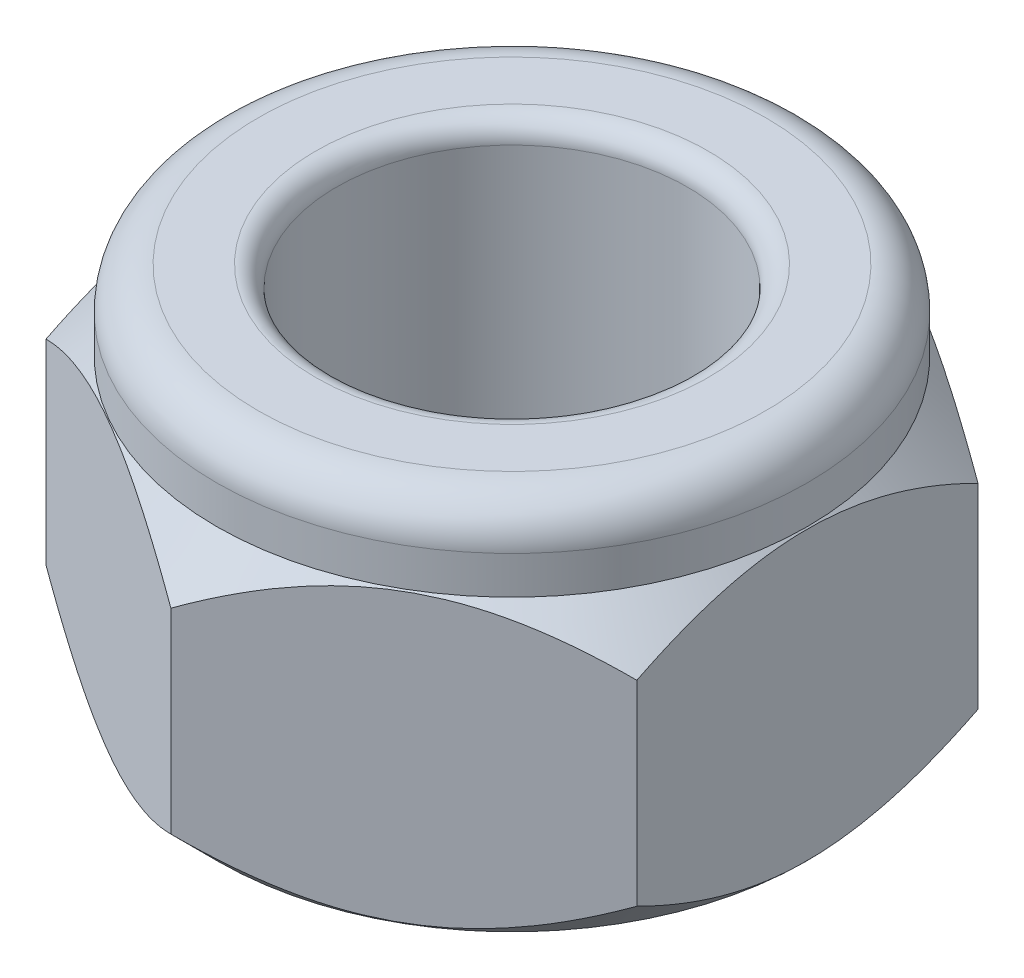
from build123d import *
from build123d.topology import SkipClean

# Parameters (mm, degrees)
SKETCH1_R                   = 4
BOSS_EXTRUDE1_DEPTH         = 7
F_3_8_24_TAPPED_HOLE6_D     = 8.4328
F_3_8_24_TAPPED_HOLE6_DEPTH = 15.3
F_3_8_24_TAPPED_HOLE6_TIP   = 2.533468714
SKETCH9_R                   = 7.1
SKETCH9_R_2                 = 4.2164
BOSS_EXTRUDE3_DEPTH         = 1.91
FILLET3_R                   = 1
FILLET4_R                   = 0.5


with BuildPart() as part:
    # Sketch1 → Boss-Extrude1 (new body)
    with BuildSketch(Plane(origin=(0, 0, 0), x_dir=(1, 0, 0), z_dir=(0, 1, 0))):
        Polygon((0, 8.198373822), (-7.1, 4.099186911), (-7.1, -4.099186911), (0, -8.198373822), (7.1, -4.099186911), (7.1, 4.099186911), align=None)
        Circle(SKETCH1_R, mode=Mode.SUBTRACT)
    extrude(amount=BOSS_EXTRUDE1_DEPTH)

    # 3/8-24 Tapped Hole6
    with Locations(Plane.ZX.offset(7)):
        with Locations((0, 0)):
            Hole(F_3_8_24_TAPPED_HOLE6_D / 2, depth=F_3_8_24_TAPPED_HOLE6_DEPTH)
            with Locations((0, 0, -(F_3_8_24_TAPPED_HOLE6_DEPTH + F_3_8_24_TAPPED_HOLE6_TIP / 2))):  # 118° drill point
                Cone(0, F_3_8_24_TAPPED_HOLE6_D / 2, F_3_8_24_TAPPED_HOLE6_TIP, mode=Mode.SUBTRACT)

    # Sketch8 → Cut-Revolve4 (revolve, cut)
    with BuildSketch(Plane.XY):
        Polygon((-6.55, -0.5), (-8.05, -0.5), (-11.05, -0.5), (-11.05, 1), (-11.05, 1.5), (-8.55, 1.5), align=None)
        Polygon((-11.05, 5.5), (-11.05, 6), (-11.05, 7.5), (-8.05, 7.5), (-6.55, 7.5), (-8.55, 5.5), align=None)
    revolve(axis=Axis((0, 0, 0), (0, 1, 0)), mode=Mode.SUBTRACT)

    # Sketch9 → Boss-Extrude3 (add)
    with SkipClean():  # the faces are left unmerged after this step: merging them gives an invalid solid
        with BuildSketch(Plane(origin=(0, 7, 0), x_dir=(1, 0, 0), z_dir=(0, 1, 0))):
            Circle(SKETCH9_R)
            Circle(SKETCH9_R_2, mode=Mode.SUBTRACT)
        extrude(amount=BOSS_EXTRUDE3_DEPTH)
    add(part.part.scale(1), mode=Mode.REPLACE)  # the faces are merged on a copy

    # Fillet3
    fillet3_edges = [part.edges().sort_by_distance(p)[0] for p in [
        (-7.1, 8.91, 0),
    ]]
    fillet(fillet3_edges, radius=FILLET3_R)

    # Fillet4
    fillet4_edges = [part.edges().sort_by_distance(p)[0] for p in [
        (-4.2164, 8.91, 0),
    ]]
    fillet(fillet4_edges, radius=FILLET4_R)


solid = part.part
